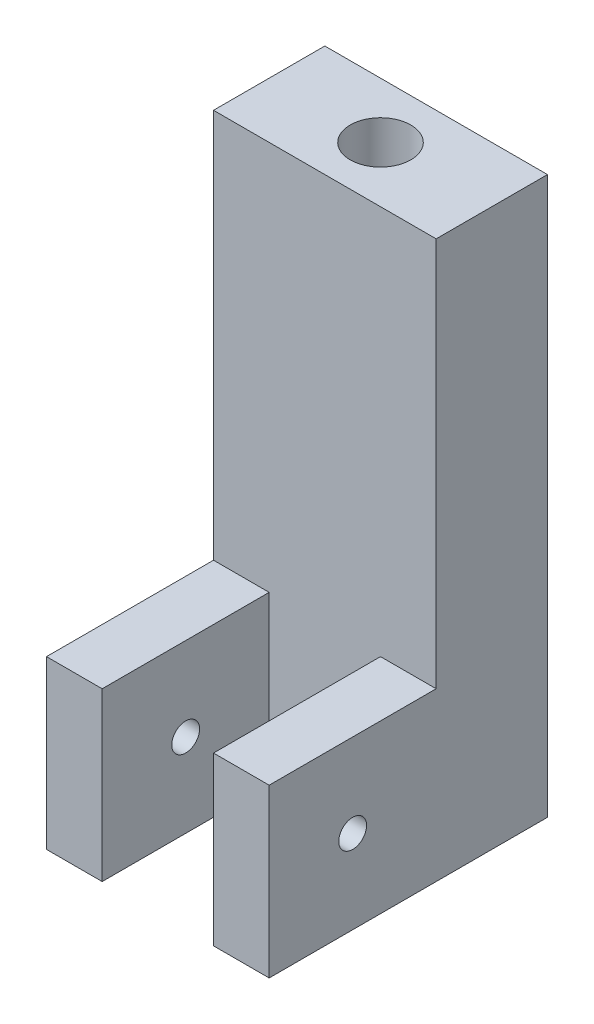
from build123d import *

# Parameters (mm, degrees)
BOSS_EXTRUDE1_DEPTH      = 25.4
SKETCH2_R                = 1.5875
CUT_EXTRUDE1_DEPTH       = 76.402072253
SKETCH3_W                = 12.7
SKETCH3_H                = 19.05
CUT_EXTRUDE2_DEPTH       = 19.05
F_5_16_24_TAPPED_HOLE1_D = 6.9088


with BuildPart() as part:
    # Sketch1 → Boss-Extrude1 (new body)
    with BuildSketch(Plane(origin=(0, 0, 0), x_dir=(0, 0, -1), z_dir=(1, 0, 0))):
        Polygon((0, 0), (0, 63.5), (-12.7, 63.5), (-12.7, 19.05), (-31.75, 19.05), (-31.75, 0), align=None)
    extrude(amount=BOSS_EXTRUDE1_DEPTH)

    # Sketch2 → Cut-Extrude1 (cut, through all)
    with BuildSketch(Plane(origin=(25.4, 0, 0), x_dir=(0, 0, -1), z_dir=(1, 0, 0))):
        with Locations((-22.225, 9.525)):
            Circle(SKETCH2_R)
    extrude(amount=-CUT_EXTRUDE1_DEPTH, mode=Mode.SUBTRACT)

    # Sketch3 → Cut-Extrude2 (cut)
    with BuildSketch(Plane.XY.offset(31.75)):
        with Locations((12.7, 9.525)):
            Rectangle(SKETCH3_W, SKETCH3_H)
    extrude(amount=-CUT_EXTRUDE2_DEPTH, mode=Mode.SUBTRACT)

    # 5/16-24 Tapped Hole1 (through all)
    with Locations(Plane(origin=(0, 63.5, 0), x_dir=(1, 0, 0), z_dir=(0, 1, 0))):
        with Locations((12.7, -6.35)):
            Hole(F_5_16_24_TAPPED_HOLE1_D / 2)


solid = part.part
